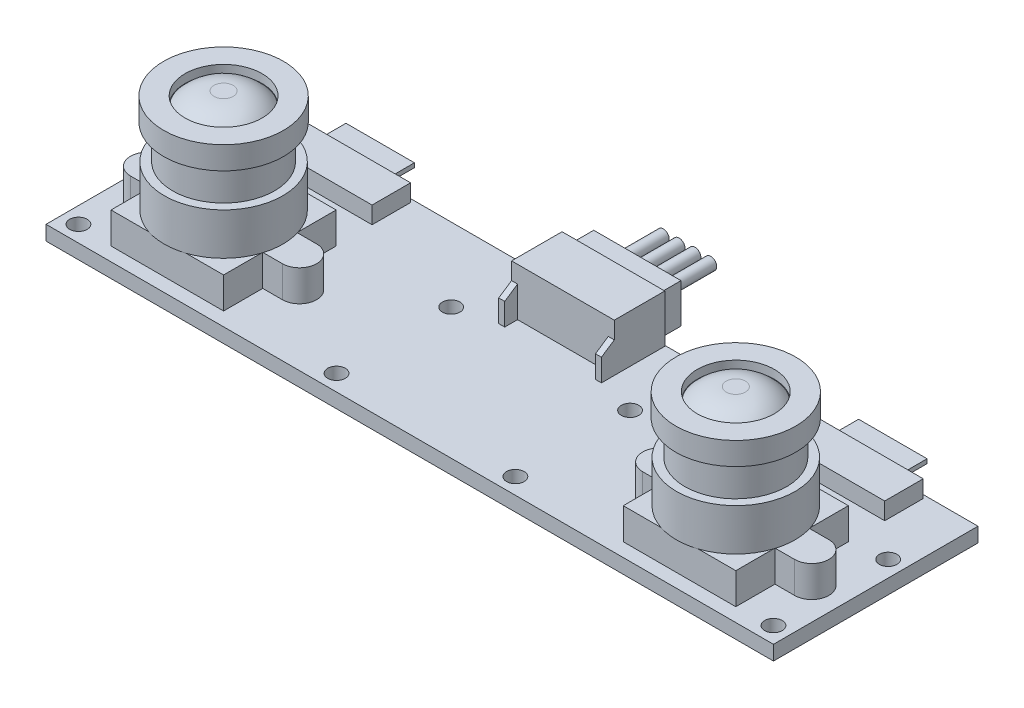
from build123d import *
from OCP.BRepFilletAPI import BRepFilletAPI_MakeChamfer

# Parameters (mm, degrees)
SKETCH1_W            = 85
SKETCH1_H            = 23.9
BOSS_EXTRUDE1_DEPTH  = 1.7
SKETCH2_R            = 1.025
CUT_EXTRUDE1_DEPTH   = 45.180793338
SKETCH3_W            = 12
SKETCH3_H            = 6
BOSS_EXTRUDE2_DEPTH  = 5.6
SKETCH4_W            = 0.7
SKETCH4_H            = 1.5
BOSS_EXTRUDE3_DEPTH  = 3.6
CHAMFER1_SIZE        = 1.5
CHAMFER1_SIZE_2      = 1
SKETCH5_W            = 12
SKETCH5_H            = 5.6
CUT_EXTRUDE2_DEPTH   = 0.1
SKETCH6_W            = 10.2
SKETCH6_H            = 4.6
BOSS_EXTRUDE4_DEPTH  = 2.8
SKETCH7_R            = 0.7
BOSS_EXTRUDE5_DEPTH  = 5.8
BOSS_EXTRUDE6_DEPTH  = 3.65
SKETCH9_R            = 6.925
BOSS_EXTRUDE7_DEPTH  = 4.9
SKETCH10_R           = 5.95
BOSS_EXTRUDE8_DEPTH  = 4
SKETCH11_R           = 7
BOSS_EXTRUDE9_DEPTH  = 2.65
SKETCH12_R           = 4.5
CUT_EXTRUDE3_DEPTH   = 1
SKETCH13_R           = 4.45
BOSS_EXTRUDE10_DEPTH = 1.5
FILLET1_R            = 4.45
SKETCH14_W           = 13.1
SKETCH14_H           = 4.5
BOSS_EXTRUDE11_DEPTH = 2
SKETCH15_W           = 8
SKETCH15_H           = 0.5
BOSS_EXTRUDE12_DEPTH = 3


# Some blends are built 0.0001 mm under size
with BuildPart() as part:
    # Sketch1 → Boss-Extrude1 (new body)
    with BuildSketch(Plane(origin=(0, 0, 0), x_dir=(1, 0, 0), z_dir=(0, 1, 0))):
        Rectangle(SKETCH1_W, SKETCH1_H)
    extrude(amount=BOSS_EXTRUDE1_DEPTH)

    # Sketch2 → Cut-Extrude1 (cut, through all)
    with BuildSketch(Plane(origin=(0, 1.7, 0), x_dir=(1, 0, 0), z_dir=(0, 1, 0))):
        with Locations(Location((-40.605, 3.345, 0), (0, 0, 270))):
            Circle(SKETCH2_R)
        with Locations(Location((-10.45, 3.345, 0), (0, 0, 270))):
            Circle(SKETCH2_R)
        with Locations(Location((-40.605, -10.055, 0), (0, 0, 270))):
            Circle(SKETCH2_R)
        with Locations(Location((-10.45, -10.055, 0), (0, 0, 270))):
            Circle(SKETCH2_R)
        with Locations(Location((10.45, 3.345, 0), (0, 0, 270))):
            Circle(SKETCH2_R)
        with Locations(Location((40.605, 3.345, 0), (0, 0, 270))):
            Circle(SKETCH2_R)
        with Locations(Location((40.605, -10.055, 0), (0, 0, 270))):
            Circle(SKETCH2_R)
        with Locations(Location((10.45, -10.055, 0), (0, 0, 270))):
            Circle(SKETCH2_R)
    extrude(amount=-CUT_EXTRUDE1_DEPTH, mode=Mode.SUBTRACT)

    # Sketch3 → Boss-Extrude2 (add)
    with BuildSketch(Plane(origin=(0, 1.7, 0), x_dir=(1, 0, 0), z_dir=(0, 1, 0))):
        with Locations((0, 8.95)):
            Rectangle(SKETCH3_W, SKETCH3_H)
    extrude(amount=BOSS_EXTRUDE2_DEPTH)

    # Sketch4 → Boss-Extrude3 (add)
    with BuildSketch(Plane(origin=(0, 1.7, 0), x_dir=(1, 0, 0), z_dir=(0, 1, 0))):
        with Locations((-5.65, 5.2)):
            Rectangle(SKETCH4_W, SKETCH4_H)
        with Locations((5.65, 5.2)):
            Rectangle(SKETCH4_W, SKETCH4_H)
    extrude(amount=BOSS_EXTRUDE3_DEPTH)

    # Chamfer1
    chamfer1_edges_1 = [part.edges().sort_by_distance(p)[0] for p in [
        (-5.65, 5.3, -4.45),
    ]]
    chamfer1_side_1 = [part.faces().sort_by_distance(p)[0] for p in [
        (-5.65, 5.3, -4.47),
    ]]
    chamfer1_edges_2 = [part.edges().sort_by_distance(p)[0] for p in [
        (5.65, 5.3, -4.45),
    ]]
    chamfer1_side_2 = [part.faces().sort_by_distance(p)[0] for p in [
        (5.65, 5.3, -4.47),
    ]]
    chamfer1 = BRepFilletAPI_MakeChamfer(part.part.solid().wrapped)
    for e in chamfer1_edges_1:
        chamfer1.Add(CHAMFER1_SIZE - 0.0001, CHAMFER1_SIZE_2 - 0.0001, e.wrapped, chamfer1_side_1[0].wrapped)
    for e in chamfer1_edges_2:
        chamfer1.Add(CHAMFER1_SIZE - 0.0001, CHAMFER1_SIZE_2 - 0.0001, e.wrapped, chamfer1_side_2[0].wrapped)
    add(Compound.cast(chamfer1.Shape()), mode=Mode.REPLACE)  # a hair under: the kernel refuses the full size

    # Sketch5 → Cut-Extrude2 (cut)
    with BuildSketch(Plane(origin=(0, 0, -11.95), x_dir=(-1, 0, 0), z_dir=(0, 0, -1))):
        with Locations((0, 4.5)):
            Rectangle(SKETCH5_W, SKETCH5_H)
    extrude(amount=-CUT_EXTRUDE2_DEPTH, mode=Mode.SUBTRACT)

    # Sketch6 → Boss-Extrude4 (add)
    with BuildSketch(Plane(origin=(0, 0, -11.85), x_dir=(-1, 0, 0), z_dir=(0, 0, -1))):
        with Locations((0, 4.2)):
            Rectangle(SKETCH6_W, SKETCH6_H)
    extrude(amount=BOSS_EXTRUDE4_DEPTH)

    # Sketch7 → Boss-Extrude5 (add)
    with BuildSketch(Plane(origin=(0, 0, -14.65), x_dir=(-1, 0, 0), z_dir=(0, 0, -1))):
        with Locations((0.925, 4.2)):
            Circle(SKETCH7_R)
        with Locations((-0.925, 4.2)):
            Circle(SKETCH7_R)
        with Locations((-2.775, 4.2)):
            Circle(SKETCH7_R)
        with Locations((2.775, 4.2)):
            Circle(SKETCH7_R)
    extrude(amount=BOSS_EXTRUDE5_DEPTH)

    # Sketch8 → Boss-Extrude6 (add)
    with BuildSketch(Plane(origin=(0, 1.7, 0), x_dir=(1, 0, 0), z_dir=(0, 1, 0))):
        with BuildLine():
            Line((-36.5, -10.35), (-23.35, -10.35))
            Line((-23.35, -10.35), (-23.35, -5.775))
            Line((-23.35, -5.775), (-21.05, -5.775))
            ThreePointArc((-21.05, -5.775), (-19.05, -3.775), (-21.05, -1.775))
            Line((-21.05, -1.775), (-23.35, -1.775))
            Line((-23.35, -1.775), (-23.35, 2.8))
            Line((-23.35, 2.8), (-36.5, 2.8))
            Line((-36.5, 2.8), (-36.5, -1.775))
            Line((-36.5, -1.775), (-38.8, -1.775))
            ThreePointArc((-38.8, -1.775), (-40.8, -3.775), (-38.8, -5.775))
            Line((-38.8, -5.775), (-36.5, -5.775))
            Line((-36.5, -5.775), (-36.5, -10.35))
        make_face()
        with BuildLine():
            Line((23.35, -1.775), (23.35, 2.8))
            Line((23.35, 2.8), (36.5, 2.8))
            Line((36.5, 2.8), (36.5, -1.775))
            Line((36.5, -1.775), (38.8, -1.775))
            ThreePointArc((38.8, -1.775), (40.8, -3.775), (38.8, -5.775))
            Line((38.8, -5.775), (36.5, -5.775))
            Line((36.5, -5.775), (36.5, -10.35))
            Line((36.5, -10.35), (23.35, -10.35))
            Line((23.35, -10.35), (23.35, -5.775))
            Line((23.35, -5.775), (21.05, -5.775))
            ThreePointArc((21.05, -5.775), (19.05, -3.775), (21.05, -1.775))
            Line((21.05, -1.775), (23.35, -1.775))
        make_face()
    extrude(amount=BOSS_EXTRUDE6_DEPTH)

    # Sketch9 → Boss-Extrude7 (add)
    with BuildSketch(Plane(origin=(0, 5.35, 0), x_dir=(1, 0, 0), z_dir=(0, 1, 0))):
        with Locations(Location((-29.925, -3.775, 0), (0, 0, 71.706023749))):
            Circle(SKETCH9_R)
        with Locations(Location((29.925, -3.775, 0), (0, 0, 71.706023749))):
            Circle(SKETCH9_R)
    extrude(amount=BOSS_EXTRUDE7_DEPTH)

    # Sketch10 → Boss-Extrude8 (add)
    with BuildSketch(Plane(origin=(0, 10.25, 0), x_dir=(1, 0, 0), z_dir=(0, 1, 0))):
        with Locations(Location((-29.925, -3.775, 0), (0, 0, 270))):
            Circle(SKETCH10_R)
        with Locations(Location((29.925, -3.775, 0), (0, 0, 270))):
            Circle(SKETCH10_R)
    extrude(amount=BOSS_EXTRUDE8_DEPTH)

    # Sketch11 → Boss-Extrude9 (add)
    with BuildSketch(Plane(origin=(0, 14.25, 0), x_dir=(1, 0, 0), z_dir=(0, 1, 0))):
        with Locations(Location((-29.925, -3.775, 0), (0, 0, 270))):
            Circle(SKETCH11_R)
        with Locations(Location((29.925, -3.775, 0), (0, 0, 270))):
            Circle(SKETCH11_R)
    extrude(amount=BOSS_EXTRUDE9_DEPTH)

    # Sketch12 → Cut-Extrude3 (cut)
    with BuildSketch(Plane(origin=(0, 16.9, 0), x_dir=(1, 0, 0), z_dir=(0, 1, 0))):
        with Locations(Location((-29.925, -3.775, 0), (0, 0, 270))):
            Circle(SKETCH12_R)
        with Locations(Location((29.925, -3.775, 0), (0, 0, 270))):
            Circle(SKETCH12_R)
    extrude(amount=-CUT_EXTRUDE3_DEPTH, mode=Mode.SUBTRACT)

    # Sketch13 → Boss-Extrude10 (add)
    with BuildSketch(Plane(origin=(0, 15.9, 0), x_dir=(1, 0, 0), z_dir=(0, 1, 0))):
        with Locations(Location((-29.925, -3.775, 0), (0, 0, 270))):
            Circle(SKETCH13_R)
        with Locations(Location((29.925, -3.775, 0), (0, 0, 270))):
            Circle(SKETCH13_R)
    extrude(amount=BOSS_EXTRUDE10_DEPTH)

    # Fillet1
    # the kernel refuses this fillet: 4.45 mm, written as the material it takes off along each edge
    with BuildSketch(Plane(origin=(-29.925, 17.4, 3.775), x_dir=(0, 0, 1), z_dir=(-1, 0, 0))) as fillet1_piece_1:
        with BuildLine():
            CenterArc((1.11833375, -4.45), FILLET1_R, 41.52305383, 48.47694617)
            Line((1.11833375, 0), (4.45, 0))
            Line((4.45, 0), (4.45, -1.5))
        make_face()
    revolve(axis=Axis((-29.925, 17.4, 3.775), (0, 1, 0)), mode=Mode.SUBTRACT)
    with BuildSketch(Plane(origin=(29.925, 17.4, 3.775), x_dir=(0, 0, 1), z_dir=(-1, 0, 0))) as fillet1_piece_2:
        with BuildLine():
            CenterArc((1.11833375, -4.45), FILLET1_R, 41.52305383, 48.47694617)
            Line((1.11833375, 0), (4.45, 0))
            Line((4.45, 0), (4.45, -1.5))
        make_face()
    revolve(axis=Axis((29.925, 17.4, 3.775), (0, 1, 0)), mode=Mode.SUBTRACT)

    # Sketch14 → Boss-Extrude11 (add)
    with BuildSketch(Plane(origin=(0, 1.7, 0), x_dir=(1, 0, 0), z_dir=(0, 1, 0))):
        with Locations((-29.95, 9.3)):
            Rectangle(SKETCH14_W, SKETCH14_H)
        with Locations((29.95, 9.3)):
            Rectangle(SKETCH14_W, SKETCH14_H)
    extrude(amount=BOSS_EXTRUDE11_DEPTH)

    # Sketch15 → Boss-Extrude12 (add)
    with BuildSketch(Plane(origin=(0, 0, -11.55), x_dir=(-1, 0, 0), z_dir=(0, 0, -1))):
        with Locations((-29.95, 2.7)):
            Rectangle(SKETCH15_W, SKETCH15_H)
        with Locations((29.95, 2.7)):
            Rectangle(SKETCH15_W, SKETCH15_H)
    extrude(amount=BOSS_EXTRUDE12_DEPTH)


solid = part.part
